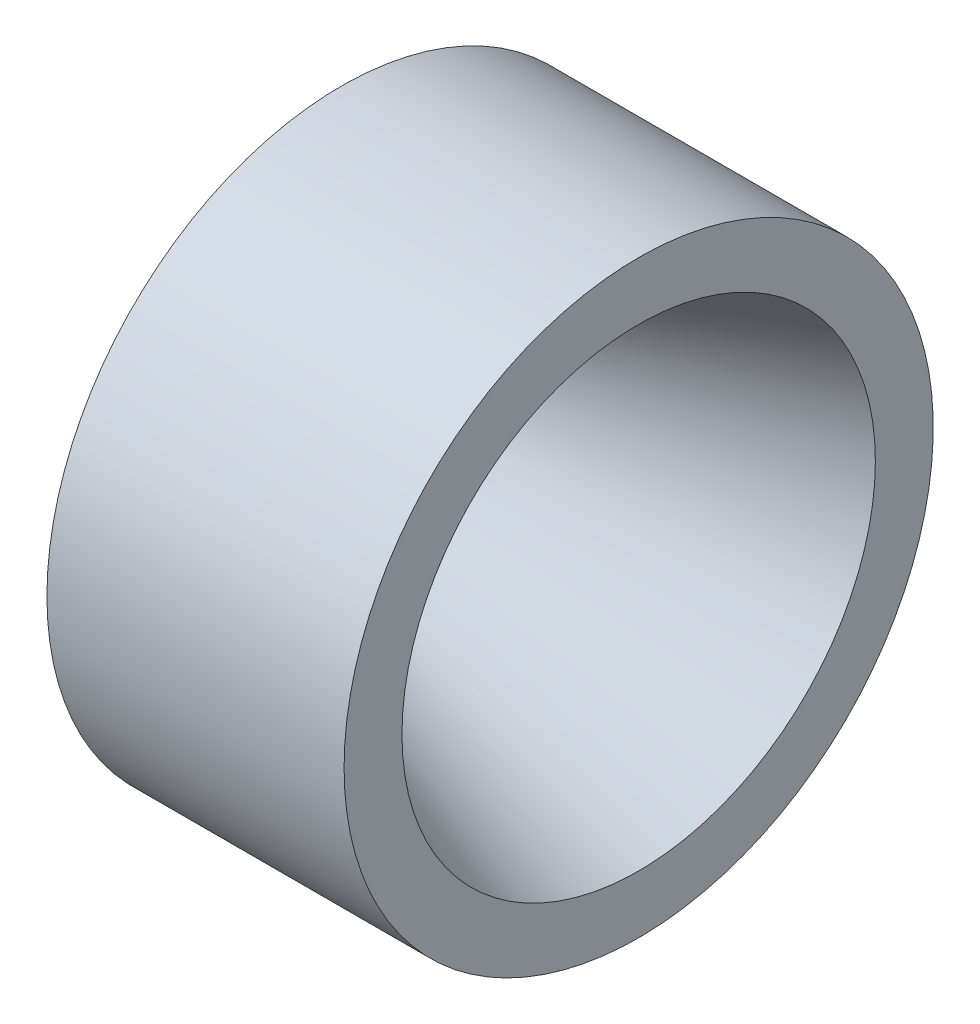
from build123d import *

# Parameters (mm, degrees)
CUT_EXTRUDE1_DEPTH = 30.48
CIRPATTERN1_COUNT  = 12


with BuildPart() as part:
    # Sketch1 → Revolve1 (revolve)
    with BuildSketch(Plane.XY):
        Polygon((280.911030354, 30.48), (351.369552102, 56.124804667), (351.369552102, 69.85), (280.911030354, 69.85), (280.911030354, 50.8), align=None)
    revolve(axis=Axis((0, 0, 0), (1, 0, 0)))

    # Sketch4 → Cut-Extrude1 (cut)
    with BuildSketch(Plane.ZY.offset(-280.911030354)):
        with BuildLine():
            ThreePointArc((0, 57.15), (1.796051224, 57.893948776), (2.54, 59.69))
            ThreePointArc((2.54, 59.69), (-1.796051224, 61.486051224), (0, 57.15))
        make_face()
    cut_extrude1 = extrude(amount=-CUT_EXTRUDE1_DEPTH, mode=Mode.SUBTRACT)

    # CirPattern1: Cut-Extrude1 ×12 about axis
    cirpattern1_axis = Axis((280.911030354, 0, 0), (-1, 0, 0))
    for i in range(1, CIRPATTERN1_COUNT):
        add(cut_extrude1.rotate(cirpattern1_axis, i * 360 / CIRPATTERN1_COUNT), mode=Mode.SUBTRACT)


solid = part.part
